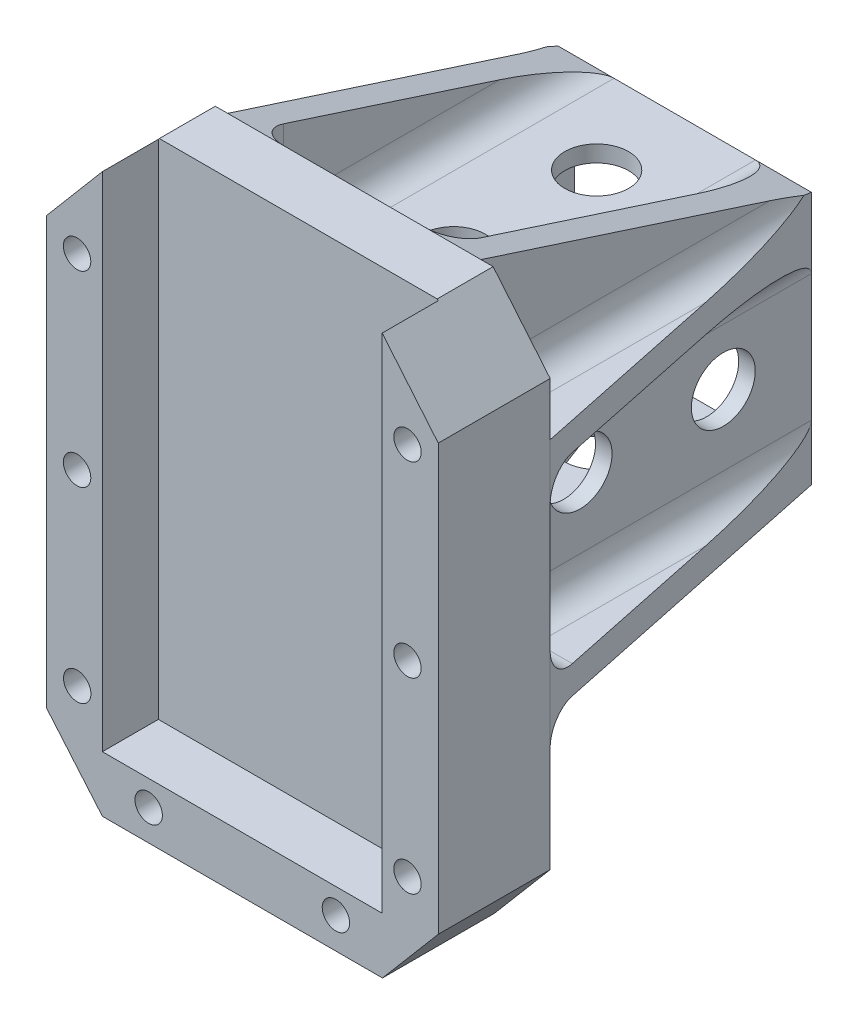
from build123d import *

# Parameters (mm, degrees)
SKETCH1_W                     = 35.56
SKETCH1_H                     = 50.8
BOSS_EXTRUDE1_DEPTH           = 10.16
SKETCH2_W                     = 25.4
SKETCH2_H                     = 45.72
CUT_EXTRUDE2_DEPTH            = 5.08
F_40_0_098_DIAMETER_HOLE1_D   = 2.4892
SKETCH7_W                     = 23
SKETCH7_H                     = 23
SKETCH7_W_2                   = 20
SKETCH7_H_2                   = 20
BOSS_EXTRUDE2_DEPTH           = 30
CUT_EXTRUDE3_DEPTH            = 74.878137497
RIB17_REACH                   = 58.869
SKETCH12_WALL_W               = 146.388686102
SKETCH12_WALL_H               = 2.54
M5_CLEARANCE_HOLE2_AT_2_COUNT = 2
M5_CLEARANCE_HOLE2_AT_2_PITCH = 12.999999966
CIRPATTERN2_COUNT             = 4
LPATTERN3_COUNT               = 2
LPATTERN3_PITCH               = 19.143333316
MIRROR2_COPY_1_REACH          = 58.869
MIRROR2_COPY_1_SKETCH_W       = 146.388686102
MIRROR2_COPY_1_SKETCH_H       = 2.54
RIB18_REACH                   = 67.863
SKETCH20_WALL_W               = 165.256981074
SKETCH20_WALL_H               = 2.54
RIB19_START                   = -2.54
RIB19_DEPTH                   = 2.54
RIB27_REACH                   = 65.527
SKETCH23_WALL_W               = 164.089399604
SKETCH23_WALL_H               = 1.778
FILLET1_R                     = 2.54


# Read off the part's stored shape, not the designer's step: Rib19
with BuildPart() as part:
    # Sketch1 → Boss-Extrude1 (new body)
    with BuildSketch(Plane.XY):
        with Locations((-17.78, 25.4)):
            Rectangle(SKETCH1_W, SKETCH1_H)
    extrude(amount=BOSS_EXTRUDE1_DEPTH)

    # Sketch2 → Cut-Extrude2 (cut)
    with BuildSketch(Plane.XY.offset(10.16)):
        with Locations((-17.792594088, 27.94)):
            Rectangle(SKETCH2_W, SKETCH2_H)
    extrude(amount=-CUT_EXTRUDE2_DEPTH, mode=Mode.SUBTRACT)

    # #40 (0.098) Diameter Hole1 (through all)
    with Locations(Plane(origin=(0, 0, 0), x_dir=(-1, 0, 0), z_dir=(0, 0, -1))):
        with Locations((2.792369004, 43.087106138), (2.792369004, 26.092979092), (2.792369004, 9.105182099), (9.290740849, 2.822744672), (26.292369004, 2.787106138), (32.780032006, 9.105182099), (32.792369004, 26.087106138), (32.792369004, 43.087106138)):
            Hole(F_40_0_098_DIAMETER_HOLE1_D / 2)

    # Sketch7 → Boss-Extrude2 (add)
    with BuildSketch(Plane(origin=(0, 0, 0), x_dir=(-1, 0, 0), z_dir=(0, 0, -1))):
        with Locations((17.78, 29.595354636)):
            Rectangle(SKETCH7_W, SKETCH7_H)
        with Locations((17.78, 29.595354636)):
            Rectangle(SKETCH7_W_2, SKETCH7_H_2, mode=Mode.SUBTRACT)
    extrude(amount=BOSS_EXTRUDE2_DEPTH)

    # Sketch8 → Cut-Extrude3 (cut, through all)
    with BuildSketch(Plane.XY.offset(10.16)):
        Polygon((-5.178964387, 50.8), (0, 44.591495864), (0, 50.8), align=None)
        Polygon((-35.56, 44.706622517), (-35.56, 50.8), (-30.402645731, 50.8), align=None)
        Polygon((-35.56, 5.970049098), (-35.56, 0), (-30.492594088, 0), align=None)
        Polygon((-5.092594088, -0.031324356), (0, 0), (0, 5.970049098), align=None)
    extrude(amount=-CUT_EXTRUDE3_DEPTH, mode=Mode.SUBTRACT)

    # Sketch12 wall → Rib17 (add, up to next)
    with BuildSketch(Plane(origin=(-32.42, 18.095354636, -15), x_dir=(-0.204892230188, 0, 0.978784539114), z_dir=(-0.978784539114, 0, -0.204892230188)), mode=Mode.PRIVATE) as rib17_sk1:
        with Locations((0, 1.27)):
            Rectangle(SKETCH12_WALL_W, SKETCH12_WALL_H)
    rib17_tool1 = extrude(rib17_sk1.sketch, amount=-RIB17_REACH, mode=Mode.PRIVATE) - part.part
    rib17 = rib17_tool1.solids().sort_by_distance((-32.42, 18.095354636, -15))[0]
    add(rib17)

    # Sketch19 → M5 Clearance Hole2 (revolve, cut)
    with BuildSketch(Plane(origin=(-17.78, 41.095354636, -9.000000034), x_dir=(0, 0, 1), z_dir=(1, 0, 0))):
        Polygon((0, 0), (0, 7.742483795), (2.9, 5.999988), (2.9, 0), align=None)
    m5_clearance_hole2 = revolve(axis=Axis((-17.78, 47.445354636, -9.000000034), (0, -1, 0)), mode=Mode.SUBTRACT)

    # M5 Clearance Hole2 at 2: M5 Clearance Hole2 ×2
    with Locations(*[(0, 0, -i * M5_CLEARANCE_HOLE2_AT_2_PITCH) for i in range(1, M5_CLEARANCE_HOLE2_AT_2_COUNT)]):
        add(m5_clearance_hole2, mode=Mode.SUBTRACT)

    # CirPattern2: M5 Clearance Hole2 ×4 about axis
    cirpattern2_axis = Axis((-17.78, 29.595354636, -31.5), (0, 0, 1))
    for i in range(1, CIRPATTERN2_COUNT):
        add(m5_clearance_hole2.rotate(cirpattern2_axis, i * 360 / CIRPATTERN2_COUNT), mode=Mode.SUBTRACT)

    # CirPattern2 copy 1 sketch → CirPattern2 copy 1 (revolve, cut)
    with BuildSketch(Plane(origin=(-29.28, 29.595354636, -22), x_dir=(0, 0, 1), z_dir=(0, 1, 0))):
        Polygon((0, 0), (0, 7.742483795), (2.9, 5.999988), (2.9, 0), align=None)
    revolve(axis=Axis((-35.63, 29.595354636, -22), (1, 0, 0)), mode=Mode.SUBTRACT)

    # CirPattern2 copy 2 sketch → CirPattern2 copy 2 (revolve, cut)
    with BuildSketch(Plane(origin=(-17.78, 18.095354636, -22), x_dir=(0, 0, 1), z_dir=(-1, 0, 0))):
        Polygon((0, 0), (0, 7.742483795), (2.9, 5.999988), (2.9, 0), align=None)
    revolve(axis=Axis((-17.78, 11.745354636, -22), (0, 1, 0)), mode=Mode.SUBTRACT)

    # CirPattern2 copy 3 sketch → CirPattern2 copy 3 (revolve, cut)
    with BuildSketch(Plane(origin=(-6.28, 29.595354636, -22), x_dir=(0, 0, 1), z_dir=(0, -1, 0))):
        Polygon((0, 0), (0, 7.742483795), (2.9, 5.999988), (2.9, 0), align=None)
    revolve(axis=Axis((0.07, 29.595354636, -22), (-1, 0, 0)), mode=Mode.SUBTRACT)

    # LPattern3: Rib17 ×2
    with Locations(*[(0, i * LPATTERN3_PITCH, 0) for i in range(1, LPATTERN3_COUNT)]):
        add(rib17)

    # Mirror2: Rib17 across plane
    add(rib17.mirror(Plane.ZY.offset(17.78)))

    # Mirror2 copy 1 sketch → Mirror2 copy 1 (add, up to next)
    with BuildSketch(Plane(origin=(-3.14, 37.238687952, -15), x_dir=(0.204892230188, 0, 0.978784539114), z_dir=(0.978784539114, 0, -0.204892230188)), mode=Mode.PRIVATE) as mirror2_copy_1_sk1:
        with Locations((0, -1.27)):
            Rectangle(MIRROR2_COPY_1_SKETCH_W, MIRROR2_COPY_1_SKETCH_H)
    mirror2_copy_1_tool1 = extrude(mirror2_copy_1_sk1.sketch, amount=-MIRROR2_COPY_1_REACH, mode=Mode.PRIVATE) - part.part
    add(mirror2_copy_1_tool1.solids().sort_by_distance((-3.14, 37.238687952, -15))[0])

    # Sketch20 wall → Rib18 (add, up to next)
    with BuildSketch(Plane(origin=(-6.28, 45.947677318, -15), x_dir=(0, -0.307784771149, -0.951456007732), z_dir=(0, 0.951456007732, -0.307784771149)), mode=Mode.PRIVATE) as rib18_sk1:
        with Locations((0, 1.27)):
            Rectangle(SKETCH20_WALL_W, SKETCH20_WALL_H)
    rib18_tool1 = extrude(rib18_sk1.sketch, amount=-RIB18_REACH, mode=Mode.PRIVATE) - part.part
    add(rib18_tool1.solids().sort_by_distance((-6.28, 45.947677318, -15))[0])

    # Rib19 outline → Rib19 (add)
    with BuildSketch(Plane.ZY.offset(29.28).offset(RIB19_START)):
        Polygon((0, 50.8), (-30, 41.095354636), (0, 41.095354636), align=None)
    extrude(amount=RIB19_DEPTH)

    # Sketch23 wall → Rib27 (add, up to next)
    with BuildSketch(Plane(origin=(-23.560000124, 9.047677318, -15), x_dir=(0, 0.516495609283, -0.856289837375), z_dir=(0, -0.856289837375, -0.516495609283)), mode=Mode.PRIVATE) as rib27_sk1:
        Rectangle(SKETCH23_WALL_W, SKETCH23_WALL_H)
    rib27_tool1 = extrude(rib27_sk1.sketch, amount=-RIB27_REACH, mode=Mode.PRIVATE) - part.part
    rib27 = rib27_tool1.solids().sort_by_distance((-23.560000124, 9.047677318, -15))[0]
    add(rib27)

    # Mirror3: Rib27 across plane
    add(rib27.mirror(Plane.ZY.offset(17.78)))

    # Fillet1
    # the kernel refuses this fillet: 2.54 mm, written as the material it adds along each edge
    with BuildSketch(Plane(origin=(-29.28, 20.635354636, -36.35), x_dir=(0, 1, 0), z_dir=(0, 0, 1))) as fillet1_piece_1_section:
        with BuildLine():
            CenterArc((FILLET1_R, FILLET1_R), FILLET1_R, 180, 90)
            Line((0, FILLET1_R), (0, 0))
            Line((0, 0), (FILLET1_R, 0))
        make_face()
    fillet1_piece_1 = extrude(amount=42.7, mode=Mode.PRIVATE)
    fillet1_piece_1 = split(fillet1_piece_1, bisect_by=Plane(origin=(-32.507751913, 21.276865284, -14.580802962), z_dir=(0.9787845391139913, 0, 0.20489223018799818)), keep=Keep.TOP, mode=Mode.PRIVATE)
    fillet1_piece_1 = split(fillet1_piece_1, bisect_by=Plane(origin=(-29.701450571, 21.276865284, 5.08), z_dir=(0, 0, -1)), keep=Keep.TOP, mode=Mode.PRIVATE)
    add(fillet1_piece_1)
    with BuildSketch(Plane(origin=(-22.93, 20.635354636, 0), x_dir=(0, 1, 0), z_dir=(-1, 0, 0))) as fillet1_piece_2_section:
        with BuildLine():
            CenterArc((FILLET1_R, FILLET1_R), FILLET1_R, 180, 90)
            Line((0, FILLET1_R), (0, 0))
            Line((0, 0), (FILLET1_R, 0))
        make_face()
    fillet1_piece_2 = extrude(amount=18.98, mode=Mode.PRIVATE)
    fillet1_piece_2 = split(fillet1_piece_2, bisect_by=Plane(origin=(-35.31348635, 21.207242958, -1.177612978), z_dir=(0.9787845391139913, 0, 0.20489223018799818)), keep=Keep.TOP, mode=Mode.PRIVATE)
    fillet1_piece_2 = split(fillet1_piece_2, bisect_by=Plane(origin=(-27.78, 21.207242958, -0.559647827), z_dir=(-1, 0, 0)), keep=Keep.TOP, mode=Mode.PRIVATE)
    add(fillet1_piece_2)
    with BuildSketch(Plane(origin=(-29.28, 37.238687952, 6.35), x_dir=(0, -1, 0), z_dir=(0, 0, -1))) as fillet1_piece_3_section:
        with BuildLine():
            CenterArc((FILLET1_R, FILLET1_R), FILLET1_R, 180, 90)
            Line((0, FILLET1_R), (0, 0))
            Line((0, 0), (FILLET1_R, 0))
        make_face()
    fillet1_piece_3 = extrude(amount=42.7, mode=Mode.PRIVATE)
    fillet1_piece_3 = split(fillet1_piece_3, bisect_by=Plane(origin=(-32.507751913, 36.597177304, -14.580802962), z_dir=(0.9787845391139913, 0, 0.20489223018799818)), keep=Keep.TOP, mode=Mode.PRIVATE)
    fillet1_piece_3 = split(fillet1_piece_3, bisect_by=Plane(origin=(-29.701450571, 36.597177304, 5.08), z_dir=(0, 0, -1)), keep=Keep.TOP, mode=Mode.PRIVATE)
    add(fillet1_piece_3)
    with BuildSketch(Plane(origin=(-29.28, 39.778687952, -36.35), x_dir=(0, 1, 0), z_dir=(0, 0, 1))) as fillet1_piece_4_section:
        with BuildLine():
            CenterArc((FILLET1_R, FILLET1_R), FILLET1_R, 180, 90)
            Line((0, FILLET1_R), (0, 0))
            Line((0, 0), (FILLET1_R, 0))
        make_face()
    fillet1_piece_4 = extrude(amount=42.7, mode=Mode.PRIVATE)
    fillet1_piece_4 = split(fillet1_piece_4, bisect_by=Plane(origin=(-29.702374343, 45.729179403, -15.675443274), z_dir=(0, -0.9514560077315756, 0.3077847711494059)), keep=Keep.TOP, mode=Mode.PRIVATE)
    fillet1_piece_4 = split(fillet1_piece_4, bisect_by=Plane(origin=(-32.515065023, 40.417190965, -14.545867724), z_dir=(0.9787845391139913, 0, 0.20489223018799818)), keep=Keep.TOP, mode=Mode.PRIVATE)
    fillet1_piece_4 = split(fillet1_piece_4, bisect_by=Plane(origin=(-29.702374343, 40.417190965, 5.08), z_dir=(0, 0, -1)), keep=Keep.TOP, mode=Mode.PRIVATE)
    add(fillet1_piece_4)
    with BuildSketch(Plane(origin=(-41.91, 37.238687952, 0), x_dir=(0, -1, 0), z_dir=(1, 0, 0))) as fillet1_piece_5_section:
        with BuildLine():
            CenterArc((FILLET1_R, FILLET1_R), FILLET1_R, 180, 90)
            Line((0, FILLET1_R), (0, 0))
            Line((0, 0), (FILLET1_R, 0))
        make_face()
    fillet1_piece_5 = extrude(amount=18.98, mode=Mode.PRIVATE)
    fillet1_piece_5 = split(fillet1_piece_5, bisect_by=Plane(origin=(-35.31348635, 36.66679963, -1.177612978), z_dir=(0.9787845391139913, 0, 0.20489223018799818)), keep=Keep.TOP, mode=Mode.PRIVATE)
    fillet1_piece_5 = split(fillet1_piece_5, bisect_by=Plane(origin=(-27.78, 36.66679963, -0.559647827), z_dir=(-1, 0, 0)), keep=Keep.TOP, mode=Mode.PRIVATE)
    add(fillet1_piece_5)
    with BuildSketch(Plane(origin=(-6.28, 20.635354636, -36.35), x_dir=(0, 1, 0), z_dir=(0, 0, 1))) as fillet1_piece_6_section:
        with BuildLine():
            CenterArc((FILLET1_R, -FILLET1_R), FILLET1_R, 90, 90)
            Line((0, -FILLET1_R), (0, 0))
            Line((0, 0), (FILLET1_R, 0))
        make_face()
    fillet1_piece_6 = extrude(amount=42.7, mode=Mode.PRIVATE)
    fillet1_piece_6 = split(fillet1_piece_6, bisect_by=Plane(origin=(-3.0550421, 21.27996789, -14.594150159), z_dir=(-0.9787845391139913, 0, 0.20489223018799815)), keep=Keep.TOP, mode=Mode.PRIVATE)
    fillet1_piece_6 = split(fillet1_piece_6, bisect_by=Plane(origin=(-5.863912317, 21.27996789, 5.08), z_dir=(0, 0, -1)), keep=Keep.TOP, mode=Mode.PRIVATE)
    add(fillet1_piece_6)
    with BuildSketch(Plane(origin=(-12.63, 20.635354636, 0), x_dir=(0, 1, 0), z_dir=(1, 0, 0))) as fillet1_piece_7_section:
        with BuildLine():
            CenterArc((FILLET1_R, -FILLET1_R), FILLET1_R, 90, 90)
            Line((0, -FILLET1_R), (0, 0))
            Line((0, 0), (FILLET1_R, 0))
        make_face()
    fillet1_piece_7 = extrude(amount=18.98, mode=Mode.PRIVATE)
    fillet1_piece_7 = split(fillet1_piece_7, bisect_by=Plane(origin=(-0.24651365, 21.207242958, -1.177612978), z_dir=(-0.9787845391139913, 0, 0.20489223018799815)), keep=Keep.TOP, mode=Mode.PRIVATE)
    fillet1_piece_7 = split(fillet1_piece_7, bisect_by=Plane(origin=(-7.78, 21.207242958, -0.559647827), z_dir=(1, 0, 0)), keep=Keep.TOP, mode=Mode.PRIVATE)
    add(fillet1_piece_7)
    with BuildSketch(Plane(origin=(-6.28, 37.238687952, 6.35), x_dir=(0, -1, 0), z_dir=(0, 0, -1))) as fillet1_piece_8_section:
        with BuildLine():
            CenterArc((FILLET1_R, -FILLET1_R), FILLET1_R, 90, 90)
            Line((0, -FILLET1_R), (0, 0))
            Line((0, 0), (FILLET1_R, 0))
        make_face()
    fillet1_piece_8 = extrude(amount=42.7, mode=Mode.PRIVATE)
    fillet1_piece_8 = split(fillet1_piece_8, bisect_by=Plane(origin=(-3.0550421, 36.594074698, -14.594150159), z_dir=(-0.9787845391139913, 0, 0.20489223018799818)), keep=Keep.TOP, mode=Mode.PRIVATE)
    fillet1_piece_8 = split(fillet1_piece_8, bisect_by=Plane(origin=(-5.863912317, 36.594074698, 5.08), z_dir=(0, 0, -1)), keep=Keep.TOP, mode=Mode.PRIVATE)
    add(fillet1_piece_8)
    with BuildSketch(Plane(origin=(6.35, 37.238687952, 0), x_dir=(0, -1, 0), z_dir=(-1, 0, 0))) as fillet1_piece_9_section:
        with BuildLine():
            CenterArc((FILLET1_R, -FILLET1_R), FILLET1_R, 90, 90)
            Line((0, -FILLET1_R), (0, 0))
            Line((0, 0), (FILLET1_R, 0))
        make_face()
    fillet1_piece_9 = extrude(amount=18.98, mode=Mode.PRIVATE)
    fillet1_piece_9 = split(fillet1_piece_9, bisect_by=Plane(origin=(-0.24651365, 36.66679963, -1.177612978), z_dir=(-0.9787845391139913, 0, 0.20489223018799818)), keep=Keep.TOP, mode=Mode.PRIVATE)
    fillet1_piece_9 = split(fillet1_piece_9, bisect_by=Plane(origin=(-7.78, 36.66679963, -0.559647827), z_dir=(1, 0, 0)), keep=Keep.TOP, mode=Mode.PRIVATE)
    add(fillet1_piece_9)
    with BuildSketch(Plane(origin=(-6.28, 39.778687952, -36.35), x_dir=(0, 1, 0), z_dir=(0, 0, 1))) as fillet1_piece_10_section:
        with BuildLine():
            CenterArc((FILLET1_R, -FILLET1_R), FILLET1_R, 90, 90)
            Line((0, -FILLET1_R), (0, 0))
            Line((0, 0), (FILLET1_R, 0))
        make_face()
    fillet1_piece_10 = extrude(amount=42.7, mode=Mode.PRIVATE)
    fillet1_piece_10 = split(fillet1_piece_10, bisect_by=Plane(origin=(-3.047685275, 40.420280339, -14.559006093), z_dir=(-0.9787845391139913, 0, 0.20489223018799818)), keep=Keep.TOP, mode=Mode.PRIVATE)
    fillet1_piece_10 = split(fillet1_piece_10, bisect_by=Plane(origin=(-5.862995196, 45.725785141, -15.685935969), z_dir=(0, -0.9514560077317347, 0.30778477114891417)), keep=Keep.TOP, mode=Mode.PRIVATE)
    fillet1_piece_10 = split(fillet1_piece_10, bisect_by=Plane(origin=(-5.862995196, 40.420280339, 5.08), z_dir=(0, 0, -1)), keep=Keep.TOP, mode=Mode.PRIVATE)
    add(fillet1_piece_10)
    with BuildSketch(Plane(origin=(-8.82, 57.15, 0), x_dir=(0, 0, -1), z_dir=(0, -1, 0))) as fillet1_piece_11_section:
        with BuildLine():
            CenterArc((FILLET1_R, -FILLET1_R), FILLET1_R, 90, 90)
            Line((0, -FILLET1_R), (0, 0))
            Line((0, 0), (FILLET1_R, 0))
        make_face()
    fillet1_piece_11 = extrude(amount=22.404645364, mode=Mode.PRIVATE)
    fillet1_piece_11 = split(fillet1_piece_11, bisect_by=Plane(origin=(-9.391888322, 50.167867972, -1.954111678), z_dir=(0, -0.9514560077317347, 0.30778477114891417)), keep=Keep.TOP, mode=Mode.PRIVATE)
    fillet1_piece_11 = split(fillet1_piece_11, bisect_by=Plane(origin=(-9.391888322, 39.595354636, -0.559647827), z_dir=(0, 1, 0)), keep=Keep.TOP, mode=Mode.PRIVATE)
    add(fillet1_piece_11)
    with BuildSketch(Plane(origin=(-8.82, 41.095354636, 0), x_dir=(-1, 0, 0), z_dir=(0, 0, -1))) as fillet1_piece_12_section:
        with BuildLine():
            CenterArc((FILLET1_R, FILLET1_R), FILLET1_R, 180, 90)
            Line((0, FILLET1_R), (0, 0))
            Line((0, 0), (FILLET1_R, 0))
        make_face()
    fillet1_piece_12 = extrude(amount=36.35, mode=Mode.PRIVATE)
    fillet1_piece_12 = split(fillet1_piece_12, bisect_by=Plane(origin=(-9.401958506, 45.784971986, -15.502971493), z_dir=(0, -0.9514560077317347, 0.30778477114891417)), keep=Keep.TOP, mode=Mode.PRIVATE)
    add(fillet1_piece_12)
    with BuildSketch(Plane(origin=(-26.74, 34.745354636, 0), x_dir=(1, 0, 0), z_dir=(0, 1, 0))) as fillet1_piece_13_section:
        with BuildLine():
            CenterArc((FILLET1_R, FILLET1_R), FILLET1_R, 180, 90)
            Line((0, FILLET1_R), (0, 0))
            Line((0, 0), (FILLET1_R, 0))
        make_face()
    fillet1_piece_13 = extrude(amount=22.404645364, mode=Mode.PRIVATE)
    fillet1_piece_13 = split(fillet1_piece_13, bisect_by=Plane(origin=(-26.168111678, 50.167867972, -1.954111678), z_dir=(0, -0.9514560077315756, 0.3077847711494059)), keep=Keep.TOP, mode=Mode.PRIVATE)
    fillet1_piece_13 = split(fillet1_piece_13, bisect_by=Plane(origin=(-26.168111678, 39.595354636, -0.559647827), z_dir=(0, 1, 0)), keep=Keep.TOP, mode=Mode.PRIVATE)
    add(fillet1_piece_13)
    with BuildSketch(Plane(origin=(-26.74, 41.095354636, -36.35), x_dir=(1, 0, 0), z_dir=(0, 0, 1))) as fillet1_piece_14_section:
        with BuildLine():
            CenterArc((FILLET1_R, FILLET1_R), FILLET1_R, 180, 90)
            Line((0, FILLET1_R), (0, 0))
            Line((0, 0), (FILLET1_R, 0))
        make_face()
    fillet1_piece_14 = extrude(amount=36.35, mode=Mode.PRIVATE)
    fillet1_piece_14 = split(fillet1_piece_14, bisect_by=Plane(origin=(-26.158041494, 45.784971986, -15.502971493), z_dir=(0, -0.9514560077315756, 0.3077847711494059)), keep=Keep.TOP, mode=Mode.PRIVATE)
    add(fillet1_piece_14)
    with BuildSketch(Plane(origin=(-41.91, 18.095354636, 0), x_dir=(0, -1, 0), z_dir=(1, 0, 0))) as fillet1_piece_15_section:
        with BuildLine():
            CenterArc((FILLET1_R, FILLET1_R), FILLET1_R, 180, 90)
            Line((0, FILLET1_R), (0, 0))
            Line((0, 0), (FILLET1_R, 0))
        make_face()
    fillet1_piece_15 = extrude(amount=12.63, mode=Mode.PRIVATE)
    fillet1_piece_15 = split(fillet1_piece_15, bisect_by=Plane(origin=(-35.31348635, 17.523466314, -1.177612978), z_dir=(0.9787845391139913, 0, 0.20489223018799818)), keep=Keep.TOP, mode=Mode.PRIVATE)
    add(fillet1_piece_15)
    with BuildSketch(Plane(origin=(-22.671000124, -6.35, 0), x_dir=(1, 0, 0), z_dir=(0, 1, 0))) as fillet1_piece_16_section:
        with BuildLine():
            CenterArc((FILLET1_R, FILLET1_R), FILLET1_R, 180, 90)
            Line((0, FILLET1_R), (0, 0))
            Line((0, 0), (FILLET1_R, 0))
        make_face()
    fillet1_piece_16 = extrude(amount=30.795354636, mode=Mode.PRIVATE)
    fillet1_piece_16 = split(fillet1_piece_16, bisect_by=Plane(origin=(-22.099111802, 2.706169669, -4.486515557), z_dir=(0, 0.8562898373748625, 0.516495609282917)), keep=Keep.TOP, mode=Mode.PRIVATE)
    fillet1_piece_16 = split(fillet1_piece_16, bisect_by=Plane(origin=(-22.099111802, 19.595354636, -0.559647827), z_dir=(0, -1, 0)), keep=Keep.TOP, mode=Mode.PRIVATE)
    add(fillet1_piece_16)
    with BuildSketch(Plane(origin=(-24.449000124, 18.095354636, 6.35), x_dir=(0, -1, 0), z_dir=(0, 0, -1))) as fillet1_piece_17_section:
        with BuildLine():
            CenterArc((FILLET1_R, FILLET1_R), FILLET1_R, 180, 90)
            Line((0, FILLET1_R), (0, 0))
            Line((0, 0), (FILLET1_R, 0))
        make_face()
    fillet1_piece_17 = extrude(amount=42.7, mode=Mode.PRIVATE)
    fillet1_piece_17 = split(fillet1_piece_17, bisect_by=Plane(origin=(-25.023967677, 11.110148909, -18.419338773), z_dir=(0, 0.8562898373748625, 0.516495609282917)), keep=Keep.TOP, mode=Mode.PRIVATE)
    fillet1_piece_17 = split(fillet1_piece_17, bisect_by=Plane(origin=(-25.023967677, 17.540941062, 5.08), z_dir=(0, 0, -1)), keep=Keep.TOP, mode=Mode.PRIVATE)
    add(fillet1_piece_17)
    with BuildSketch(Plane(origin=(-11.110999876, 18.095354636, 6.35), x_dir=(1, 0, 0), z_dir=(0, 0, -1))) as fillet1_piece_18_section:
        with BuildLine():
            CenterArc((FILLET1_R, FILLET1_R), FILLET1_R, 180, 90)
            Line((0, FILLET1_R), (0, 0))
            Line((0, 0), (FILLET1_R, 0))
        make_face()
    fillet1_piece_18 = extrude(amount=42.7, mode=Mode.PRIVATE)
    fillet1_piece_18 = split(fillet1_piece_18, bisect_by=Plane(origin=(-10.536032323, 11.110148909, -18.419338773), z_dir=(0, 0.8562898373748625, 0.516495609282917)), keep=Keep.TOP, mode=Mode.PRIVATE)
    fillet1_piece_18 = split(fillet1_piece_18, bisect_by=Plane(origin=(-10.536032323, 17.540941062, 5.08), z_dir=(0, 0, -1)), keep=Keep.TOP, mode=Mode.PRIVATE)
    add(fillet1_piece_18)
    with BuildSketch(Plane(origin=(-12.888999876, -6.35, 0), x_dir=(-1, 0, 0), z_dir=(0, 1, 0))) as fillet1_piece_19_section:
        with BuildLine():
            CenterArc((FILLET1_R, -FILLET1_R), FILLET1_R, 90, 90)
            Line((0, -FILLET1_R), (0, 0))
            Line((0, 0), (FILLET1_R, 0))
        make_face()
    fillet1_piece_19 = extrude(amount=30.795354636, mode=Mode.PRIVATE)
    fillet1_piece_19 = split(fillet1_piece_19, bisect_by=Plane(origin=(-13.460888198, 2.706169669, -4.486515557), z_dir=(0, 0.8562898373748625, 0.516495609282917)), keep=Keep.TOP, mode=Mode.PRIVATE)
    fillet1_piece_19 = split(fillet1_piece_19, bisect_by=Plane(origin=(-13.460888198, 19.595354636, -0.559647827), z_dir=(0, -1, 0)), keep=Keep.TOP, mode=Mode.PRIVATE)
    add(fillet1_piece_19)
    with BuildSketch(Plane(origin=(6.35, 18.095354636, 0), x_dir=(0, -1, 0), z_dir=(-1, 0, 0))) as fillet1_piece_20_section:
        with BuildLine():
            CenterArc((FILLET1_R, -FILLET1_R), FILLET1_R, 90, 90)
            Line((0, -FILLET1_R), (0, 0))
            Line((0, 0), (FILLET1_R, 0))
        make_face()
    fillet1_piece_20 = extrude(amount=12.63, mode=Mode.PRIVATE)
    fillet1_piece_20 = split(fillet1_piece_20, bisect_by=Plane(origin=(-0.24651365, 17.523466314, -1.177612978), z_dir=(-0.9787845391139913, 0, 0.20489223018799815)), keep=Keep.TOP, mode=Mode.PRIVATE)
    add(fillet1_piece_20)
    with BuildSketch(Plane(origin=(-17.460999876, 18.095354636, 0), x_dir=(0, -1, 0), z_dir=(1, 0, 0))) as fillet1_piece_21_section:
        with BuildLine():
            CenterArc((FILLET1_R, FILLET1_R), FILLET1_R, 180, 90)
            Line((0, FILLET1_R), (0, 0))
            Line((0, 0), (FILLET1_R, 0))
        make_face()
    fillet1_piece_21 = extrude(amount=11.180999876, mode=Mode.PRIVATE)
    fillet1_piece_21 = split(fillet1_piece_21, bisect_by=Plane(origin=(-12.888999876, 17.528000071, -0.567354565), z_dir=(1, 0, 0)), keep=Keep.TOP, mode=Mode.PRIVATE)
    add(fillet1_piece_21)
    with BuildSketch(Plane(origin=(-29.28, 18.095354636, 0), x_dir=(0, -1, 0), z_dir=(1, 0, 0))) as fillet1_piece_22:
        with BuildLine():
            CenterArc((FILLET1_R, FILLET1_R), FILLET1_R, 180, 90)
            Line((-FILLET1_R * 1.03586780448e-10, FILLET1_R), (0, 0))
            Line((0, 0), (FILLET1_R, 0))
        make_face()
    extrude(amount=4.830999876)


solid = part.part
